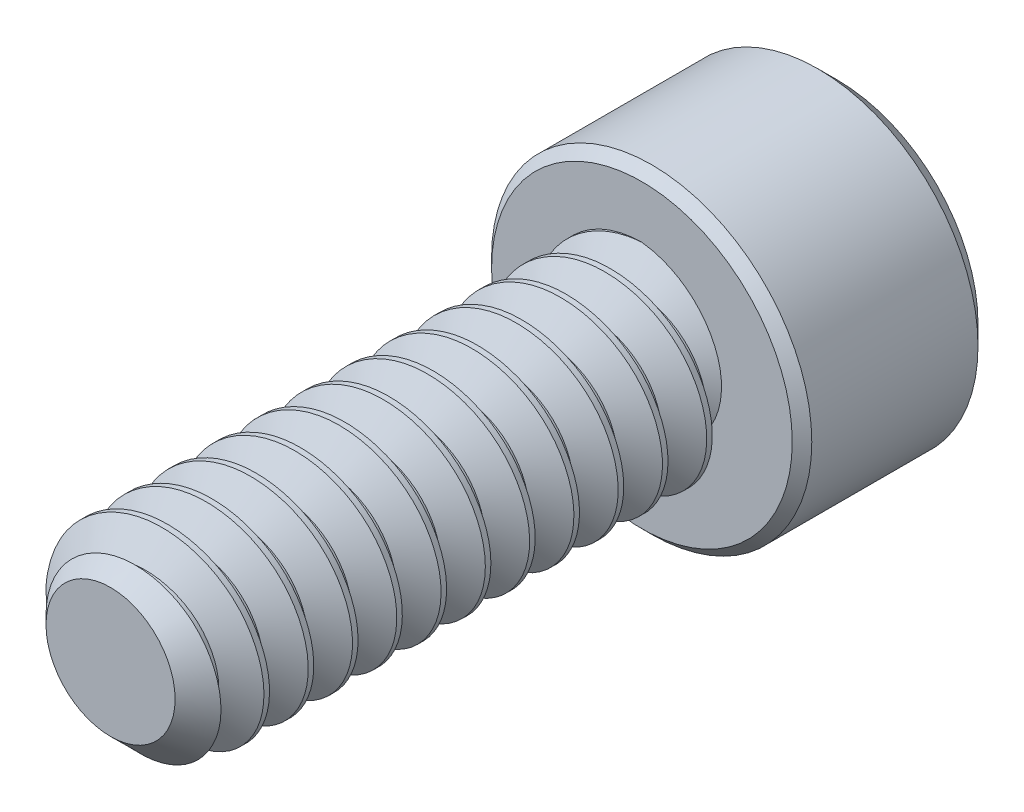
from build123d import *

# Parameters (mm, degrees)
SKETCH1_R          = 1.7526
EXTRUDE1_DEPTH     = 9.525
CHAMFER3_SIZE      = 0.5953125
CUT_SWEEP1_PITCH   = 0.79375
SKETCH6_R          = 2.8702
EXTRUDE2_DEPTH     = 3.5052
CUT_EXTRUDE1_DEPTH = 2.08359375
SKETCH8_R          = 1.603951217
CUT_EXTRUDE2_DEPTH = 0.35052
CUT_EXTRUDE2_DRAFT = -45
CHAMFER1_SIZE      = 0.35052
CHAMFER2_SIZE      = 0.17526


with BuildPart() as part:
    # Sketch1 → Extrude1 (new body)
    with BuildSketch(Plane.XY):
        Circle(SKETCH1_R)
    extrude(amount=-EXTRUDE1_DEPTH)

    # Chamfer3
    chamfer3_edges = [part.edges().sort_by_distance(p)[0] for p in [
        (-1.7526, 0, 0),
    ]]
    chamfer(chamfer3_edges, length=CHAMFER3_SIZE)

    # Cut-Sweep1: the profile of Sketch3 profile screwed along a right-hand helix of 13 turns, 6 arcs to a turn; built about Z, then put on its axis
    cut_sweep1_z = Axis((0, 0, 0), (0, 0, 1))
    cut_sweep1_corners = [(1.7529, 0, -0.694704455), (1.237044252, 0, -0.396875), (1.237044252, 0, -0.29765625), (1.7529, 0, 0.000173205)]
    with BuildLine(mode=Mode.PRIVATE) as cut_sweep1_profile:
        Line(cut_sweep1_corners[0], cut_sweep1_corners[1])
        Line(cut_sweep1_corners[1], cut_sweep1_corners[2])
        Line(cut_sweep1_corners[2], cut_sweep1_corners[3])
        Line(cut_sweep1_corners[3], cut_sweep1_corners[0])
    cut_sweep1_cap = Face(cut_sweep1_profile.wire())
    cut_sweep1_turn_angles = [0, 30, 60, 90, 120, 150, 180, 210, 240, 270, 300, 330, 360]
    cut_sweep1_turn_weights = [1, 0.8660254037844387, 1, 0.8660254037844387, 1, 0.8660254037844387, 1, 0.8660254037844387, 1, 0.8660254037844387, 1, 0.8660254037844387, 1]
    cut_sweep1_turn_rails = [Edge.make_bspline([Vector(p[0], p[1], 0).rotate(cut_sweep1_z, cut_sweep1_turn_angles[k]) / cut_sweep1_turn_weights[k] + Vector(0, 0, p[2] + CUT_SWEEP1_PITCH * cut_sweep1_turn_angles[k] / 360) for k in range(13)], [0, 0, 0, 1, 1, 2, 2, 3, 3, 4, 4, 5, 5, 6, 6, 6], 2, cut_sweep1_turn_weights) for p in cut_sweep1_corners]
    cut_sweep1_turn_sides = [Face.make_surface_from_curves(cut_sweep1_turn_rails[p[0]], cut_sweep1_turn_rails[p[1]]) for p in [(0, 1), (1, 2), (2, 3), (3, 0)]]
    cut_sweep1 = Plane(origin=(0, 0, 0), x_dir=(0, 1, 0), z_dir=(0, 0, -1)) * Solid(Shell([*[p.moved(Location((0, 0, CUT_SWEEP1_PITCH * i))) for i in range(13) for p in cut_sweep1_turn_sides], cut_sweep1_cap, cut_sweep1_cap.rotate(cut_sweep1_z, 4680).moved(Location((0, 0, CUT_SWEEP1_PITCH * 4680 / 360)))]))
    add(cut_sweep1, mode=Mode.SUBTRACT)

    # Sketch6 → Extrude2 (add)
    with BuildSketch(Plane(origin=(0, 0, -9.525), x_dir=(-1, 0, 0), z_dir=(0, 0, -1))):
        Circle(SKETCH6_R)
    extrude(amount=EXTRUDE2_DEPTH)

    # Sketch7 → Cut-Extrude1 (cut)
    with BuildSketch(Plane(origin=(0, 0, -13.0302), x_dir=(-1, 0, 0), z_dir=(0, 0, -1))):
        Polygon((0, 1.603951217), (-1.3890625, 0.801975608), (-1.3890625, -0.801975608), (0, -1.603951217), (1.3890625, -0.801975608), (1.3890625, 0.801975608), align=None)
    extrude(amount=-CUT_EXTRUDE1_DEPTH, mode=Mode.SUBTRACT)


with BuildPart() as cut_extrude2_tool:
    # Sketch8 → Cut-Extrude2 (with draft: the straight prism first)
    with BuildSketch(Plane(origin=(0, 0, -13.0302), x_dir=(-1, 0, 0), z_dir=(0, 0, -1))):
        Circle(SKETCH8_R)
    extrude(amount=-CUT_EXTRUDE2_DEPTH)
    # Cut-Extrude2: the draft: its side faces are tilted about the plane it starts from
    cut_extrude2_sides = [cut_extrude2_tool.faces().sort_by_distance(p)[0] for p in [
        (1.603951217, 0, -12.85494),
    ]]
    draft(cut_extrude2_sides, Plane(origin=(0, 0, -13.0302), x_dir=(-1, 0, 0), z_dir=(0, 0, -1)), CUT_EXTRUDE2_DRAFT)


with BuildPart() as part_1:
    add(part.part)

    # Cut-Extrude2: cut by cut_extrude2_tool
    add(cut_extrude2_tool.part, mode=Mode.SUBTRACT)

    # Chamfer1
    chamfer1_edges = [part_1.edges().sort_by_distance(p)[0] for p in [
        (2.8702, 0, -13.0302),
    ]]
    chamfer(chamfer1_edges, length=CHAMFER1_SIZE)

    # Chamfer2
    chamfer2_edges = [part_1.edges().sort_by_distance(p)[0] for p in [
        (2.8702, 0, -9.525),
    ]]
    chamfer(chamfer2_edges, length=CHAMFER2_SIZE)


solid = part_1.part
